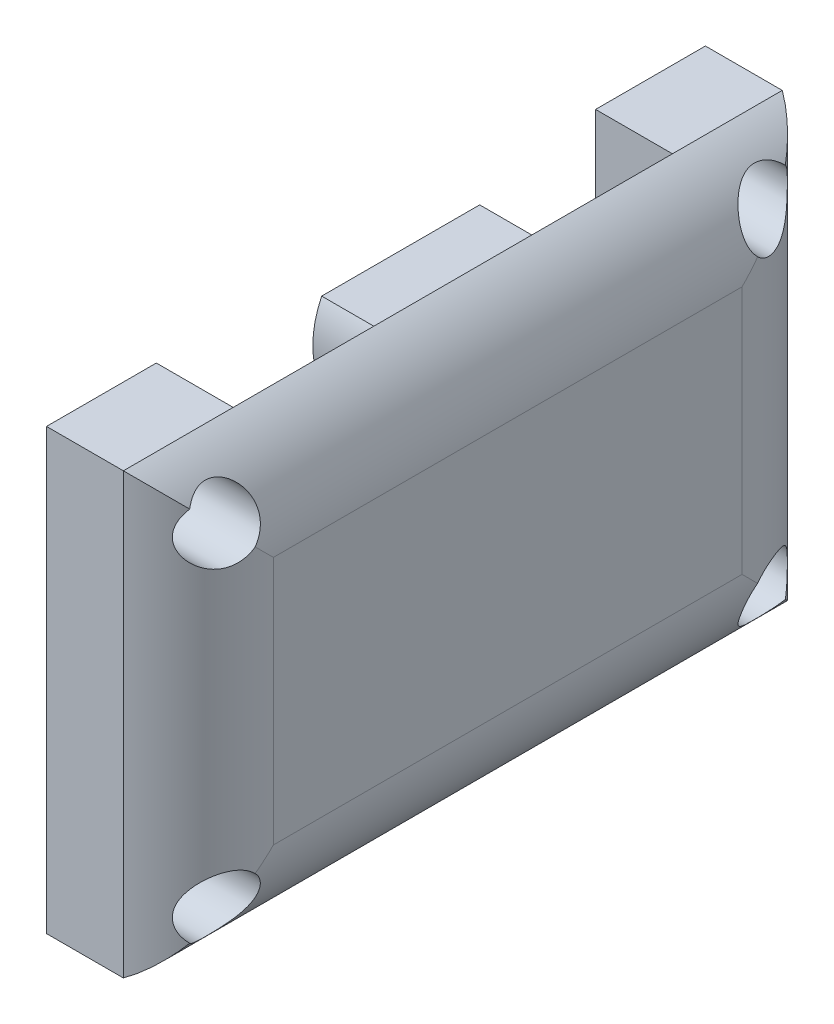
from build123d import *

# Parameters (mm, degrees)
CROQUIS1_W                 = 60
CROQUIS1_H                 = 40
SALIENTE_EXTRUIR1_DEPTH    = 5
CROQUIS3_R                 = 1.5
CORTAR_EXTRUIR1_DEPTH      = 37.400549446
REDONDEO1_R                = 10
CROQUIS5_R                 = 3
CORTAR_EXTRUIR2_DEPTH      = 3.5
CROQUIS9_W                 = 10
CROQUIS9_H                 = 40
SALIENTE_EXTRUIR3_DEPTH    = 7
CORTAR_EXTRUIR5_DEPTH      = 37.728735481
CORTAR_EXTRUIR5_DEPTH_BACK = 37.728735481
CROQUIS10_R                = 1.5
CROQUIS11_R                = 3
CORTAR_EXTRUIR6_DEPTH      = 6.63
SALIENTE_EXTRUIR4_DEPTH    = 7
CORTAR_EXTRUIR7_START      = -7
CROQUIS13_R                = 8
CORTAR_EXTRUIR7_DEPTH      = 7
CORTAR_EXTRUIR8_START      = -2.25
CORTAR_EXTRUIR8_DEPTH      = 2.25


with BuildPart() as part:
    # Croquis1 → Saliente-Extruir1 (new body)
    with BuildSketch(Plane(origin=(0, 0, 0), x_dir=(0, 0, -1), z_dir=(1, 0, 0))):
        Rectangle(CROQUIS1_W, CROQUIS1_H)
    extrude(amount=SALIENTE_EXTRUIR1_DEPTH)

    # Croquis3 → Cortar-Extruir1 (cut, through all)
    with BuildSketch(Plane(origin=(5, 0, 0), x_dir=(0, 0, -1), z_dir=(1, 0, 0))):
        with Locations((-25, 15)):
            Circle(CROQUIS3_R)
        with Locations(Location((25, 15, 0), (0, 0, 180))):
            Circle(CROQUIS3_R)
        with Locations((25, -15)):
            Circle(CROQUIS3_R)
        with Locations(Location((-25, -15, 0), (0, 0, 180))):
            Circle(CROQUIS3_R)
    extrude(amount=-CORTAR_EXTRUIR1_DEPTH, mode=Mode.SUBTRACT)

    # Redondeo1
    # the kernel refuses this fillet: 10 mm, written as the material it takes off along each edge
    with BuildSketch(Plane(origin=(5, -20, 51.650635095), x_dir=(-1, 0, 0), z_dir=(0, 0, -1))) as redondeo1_piece_1:
        with BuildLine():
            CenterArc((10, 8.660254038), REDONDEO1_R, 180, 60)
            Line((0, 8.660254038), (-0.2, 8.660254038))
            Line((-0.2, 8.660254038), (-0.2, 0))
            Line((-0.2, 0), (0, -0.2))
            ThreePointArc((0, -0.2), (2.5, -0.2), (4.9, -0.173205081))
            Line((4.9, -0.173205081), (5, 0))
        make_face()
    extrude(amount=103.301270189, mode=Mode.SUBTRACT)
    with BuildSketch(Plane(origin=(5, 20, -51.650635095), x_dir=(0, -1, 0), z_dir=(0, 0, 1))) as redondeo1_piece_2:
        with BuildLine():
            CenterArc((8.660254038, -10), REDONDEO1_R, 90, 60)
            Line((0, -5), (-0.173205081, -4.9))
            ThreePointArc((-0.173205081, -4.9), (-0.2, -2.5), (-0.2, 0))
            Line((-0.2, 0), (0, 0.2))
            Line((0, 0.2), (8.660254038, 0.2))
            Line((8.660254038, 0.2), (8.660254038, 0))
        make_face()
    extrude(amount=103.301270189, mode=Mode.SUBTRACT)
    with BuildSketch(Plane(origin=(5, 41.650635095, 30), x_dir=(-1, 0, 0), z_dir=(0, -1, 0)), Plane(origin=(5, -41.650635095, -30), x_dir=(-1, 0, 0), z_dir=(0, 1, 0))) as redondeo1_piece_3:
        with BuildLine():
            CenterArc((10, 8.660254038), REDONDEO1_R, 180, 60)
            Line((0, 8.660254038), (-0.2, 8.660254038))
            Line((-0.2, 8.660254038), (-0.2, 0))
            Line((-0.2, 0), (0, -0.2))
            ThreePointArc((0, -0.2), (2.5, -0.2), (4.9, -0.173205081))
            Line((4.9, -0.173205081), (5, 0))
        make_face()
    extrude(amount=83.301270189, mode=Mode.SUBTRACT)

    # Croquis5 → Cortar-Extruir2 (cut)
    with BuildSketch(Plane(origin=(5, 0, 0), x_dir=(0, 0, -1), z_dir=(1, 0, 0))):
        with Locations((-25, 15)):
            Circle(CROQUIS5_R)
        with Locations((25, 15)):
            Circle(CROQUIS5_R)
        with Locations((25, -15)):
            Circle(CROQUIS5_R)
        with Locations((-25, -15)):
            Circle(CROQUIS5_R)
    extrude(amount=-CORTAR_EXTRUIR2_DEPTH, mode=Mode.SUBTRACT)

    # Croquis9 → Saliente-Extruir3 (add)
    with BuildSketch(Plane.ZY):
        with Locations((-25, 0)):
            Rectangle(CROQUIS9_W, CROQUIS9_H)
        with Locations((25, 0)):
            Rectangle(CROQUIS9_W, CROQUIS9_H)
    extrude(amount=SALIENTE_EXTRUIR3_DEPTH)

    # Croquis10 → Cortar-Extruir5 (cut, two sides: drawn at the far end of the back side and taken through both)
    with BuildSketch(Plane(origin=(0, 0, 0), x_dir=(0, 0, -1), z_dir=(1, 0, 0)).offset(-CORTAR_EXTRUIR5_DEPTH_BACK)):
        with Locations((-25, -15)):
            Circle(CROQUIS10_R)
        with Locations((25, -15)):
            Circle(CROQUIS10_R)
        with Locations((25, 15)):
            Circle(CROQUIS10_R)
        with Locations((-25, 15)):
            Circle(CROQUIS10_R)
    extrude(amount=CORTAR_EXTRUIR5_DEPTH + CORTAR_EXTRUIR5_DEPTH_BACK, mode=Mode.SUBTRACT)

    # Croquis11 → Cortar-Extruir6 (cut)
    with BuildSketch(Plane(origin=(1.5, 0, 0), x_dir=(0, 0, -1), z_dir=(1, 0, 0))):
        with Locations((-25, 15)):
            Circle(CROQUIS11_R)
        with Locations((25, -15)):
            Circle(CROQUIS11_R)
        with Locations((-25, -15)):
            Circle(CROQUIS11_R)
        with Locations((25, 15)):
            Circle(CROQUIS11_R)
    extrude(amount=-CORTAR_EXTRUIR6_DEPTH, mode=Mode.SUBTRACT)

    # Croquis12 → Saliente-Extruir4 (add)
    with BuildSketch(Plane.ZY):
        with BuildLine():
            Line((-5, 6.244997998), (-5, 10.255002002))
            ThreePointArc((-5, 10.255002002), (-7.804685433, 14.743046588), (-7.193747285, 20))
            Line((-7.193747285, 20), (7.193747285, 20))
            ThreePointArc((7.193747285, 20), (7.804685433, 14.743046588), (5, 10.255002002))
            Line((5, 10.255002002), (5, 6.244997998))
            ThreePointArc((5, 6.244997998), (0, -8), (-5, 6.244997998))
        make_face()
    extrude(amount=SALIENTE_EXTRUIR4_DEPTH)

    # Croquis13 → Cortar-Extruir7 (cut)
    with BuildSketch(Plane.ZY.offset(7).offset(CORTAR_EXTRUIR7_START)):
        Circle(CROQUIS13_R)
    extrude(amount=CORTAR_EXTRUIR7_DEPTH, mode=Mode.SUBTRACT)

    # Croquis15 → Cortar-Extruir8 (cut)
    with BuildSketch(Plane.ZY.offset(7).offset(CORTAR_EXTRUIR8_START)):
        with BuildLine():
            Line((5, 6.244997998), (5, 10.255002002))
            ThreePointArc((5, 10.255002002), (7.804685433, 14.743046588), (7.193747285, 20))
            Line((7.193747285, 20), (-7.193747285, 20))
            ThreePointArc((-7.193747285, 20), (-7.804685433, 14.743046588), (-5, 10.255002002))
            Line((-5, 10.255002002), (-5, 6.244997998))
            ThreePointArc((-5, 6.244997998), (0, 8), (5, 6.244997998))
        make_face()
    extrude(amount=CORTAR_EXTRUIR8_DEPTH, mode=Mode.SUBTRACT)


solid = part.part
